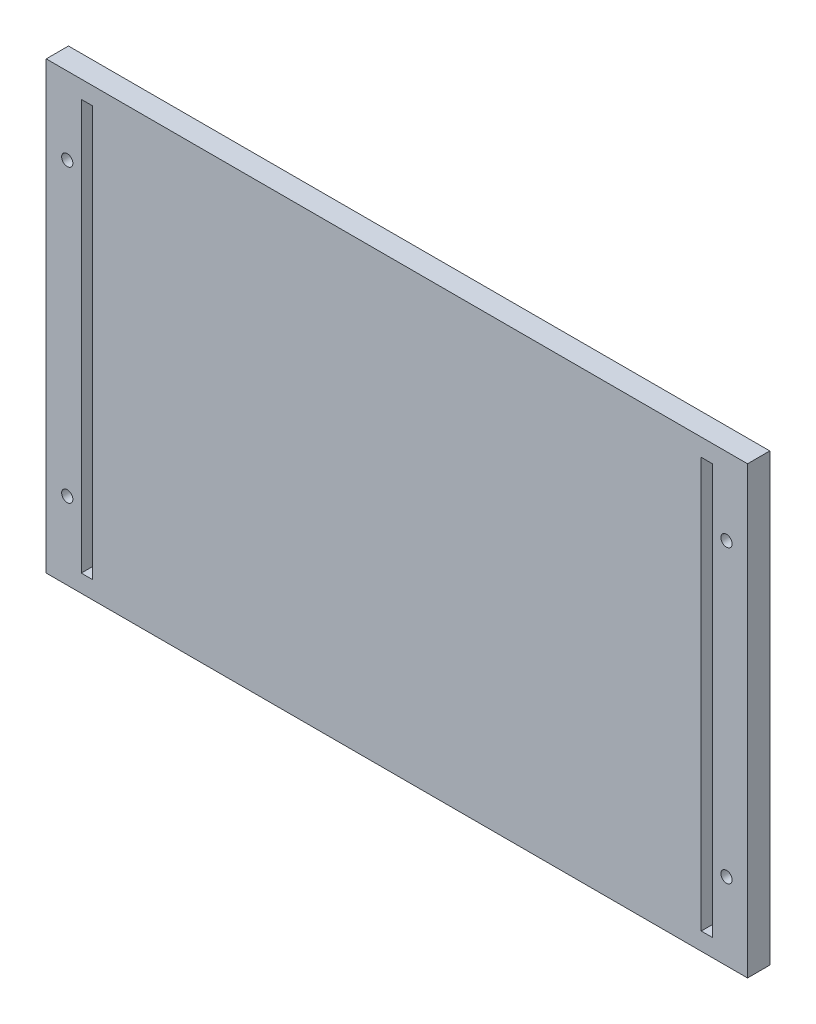
from build123d import *

# Parameters (mm, degrees)
SKETCH1_W          = 200
SKETCH1_H          = 127
SKETCH1_R          = 1.6
WALL_DEPTH         = 6.35
SKETCH6_W          = 3.2
SKETCH6_H          = 117
CUT_EXTRUDE1_DEPTH = 238.000680379


with BuildPart() as part:
    # Sketch1 → Wall (new body)
    with BuildSketch(Plane.XY):
        with Locations((100, 63.5)):
            Rectangle(SKETCH1_W, SKETCH1_H)
        with Locations((6, 105)):
            Circle(SKETCH1_R, mode=Mode.SUBTRACT)
        with Locations((194, 105)):
            Circle(SKETCH1_R, mode=Mode.SUBTRACT)
        with Locations((194, 22)):
            Circle(SKETCH1_R, mode=Mode.SUBTRACT)
        with Locations((6, 22)):
            Circle(SKETCH1_R, mode=Mode.SUBTRACT)
    extrude(amount=WALL_DEPTH)

    # Sketch6 → Cut-Extrude1 (cut, through all)
    with BuildSketch(Plane.XY.offset(6.35)):
        with Locations((11.6, 63.5)):
            Rectangle(SKETCH6_W, SKETCH6_H)
        with Locations((188.4, 63.5)):
            Rectangle(SKETCH6_W, SKETCH6_H)
    extrude(amount=-CUT_EXTRUDE1_DEPTH, mode=Mode.SUBTRACT)


solid = part.part
